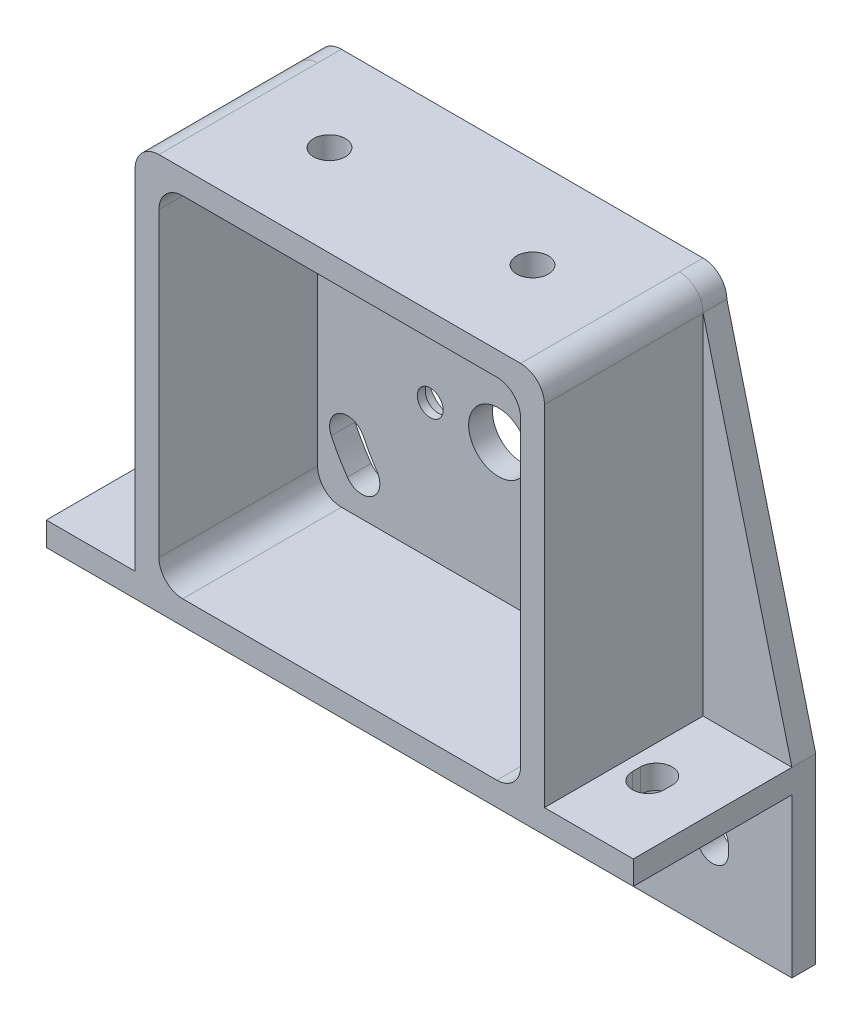
from build123d import *

# Parameters (mm, degrees)
SKETCH1_W           = 74
SKETCH1_H           = 70
SKETCH1_R           = 3.75
SKETCH1_R_2         = 1.625
BOSS_EXTRUDE1_DEPTH = 3
BOSS_EXTRUDE2_DEPTH = 20
CUT_EXTRUDE2_DEPTH  = 3
FILLET1_R           = 3
FILLET2_R           = 3
FILLET4_R           = 3
FILLET5_R           = 3
CUT_EXTRUDE4_DEPTH  = 3
FILLET6_R           = 3
FILLET7_R           = 3
FILLET8_R           = 3
FILLET9_R           = 3
SKETCH11_R          = 2
CUT_EXTRUDE5_DEPTH  = 3
SKETCH12_R          = 3.25
CUT_EXTRUDE6_DEPTH  = 2


with BuildPart() as part:
    # Sketch1 → Boss-Extrude1 (new body)
    with BuildSketch(Plane.XY):
        with Locations((37, 35)):
            Rectangle(SKETCH1_W, SKETCH1_H)
        with Locations((37, 40)):
            Circle(SKETCH1_R, mode=Mode.SUBTRACT)
        with Locations((28.4, 40)):
            Circle(SKETCH1_R_2, mode=Mode.SUBTRACT)
        with Locations((45.6, 40)):
            Circle(SKETCH1_R_2, mode=Mode.SUBTRACT)
        with BuildLine():
            Line((8, 10.5), (8, 9.5))
            ThreePointArc((8, 9.5), (10, 7.5), (12, 9.5))
            Line((12, 9.5), (12, 10.5))
            ThreePointArc((12, 10.5), (10, 12.5), (8, 10.5))
        make_face(mode=Mode.SUBTRACT)
        with BuildLine():
            Line((66, 10.5), (66, 9.5))
            ThreePointArc((66, 9.5), (64, 7.5), (62, 9.5))
            Line((62, 9.5), (62, 10.5))
            ThreePointArc((62, 10.5), (64, 12.5), (66, 10.5))
        make_face(mode=Mode.SUBTRACT)
        with BuildLine():
            ThreePointArc((34.973628981, 63.161526731), (32.928291332, 60.723988239), (35.365829823, 58.678650589))
            ThreePointArc((35.365829823, 58.678650589), (37, 58.75), (38.634170177, 58.678650589))
            ThreePointArc((38.634170177, 58.678650589), (41.071708668, 60.723988239), (39.026371019, 63.161526731))
            ThreePointArc((39.026371019, 63.161526731), (37, 63.25), (34.973628981, 63.161526731))
        make_face(mode=Mode.SUBTRACT)
        with BuildLine():
            ThreePointArc((15.928343951, 30.174125415), (17.016645383, 33.164209024), (20.006728993, 32.075907592))
            ThreePointArc((20.006728993, 32.075907592), (20.762023679, 30.625), (21.64089917, 29.245441818))
            ThreePointArc((21.64089917, 29.245441818), (21.088354052, 26.111802737), (17.95471497, 26.664347855))
            ThreePointArc((17.95471497, 26.664347855), (16.864909362, 28.375), (15.928343951, 30.174125415))
        make_face(mode=Mode.SUBTRACT)
        with BuildLine():
            ThreePointArc((58.071656049, 30.174125415), (56.983354617, 33.164209024), (53.993271007, 32.075907592))
            ThreePointArc((53.993271007, 32.075907592), (53.237976321, 30.625), (52.35910083, 29.245441818))
            ThreePointArc((52.35910083, 29.245441818), (52.911645948, 26.111802737), (56.04528503, 26.664347855))
            ThreePointArc((56.04528503, 26.664347855), (57.135090638, 28.375), (58.071656049, 30.174125415))
        make_face(mode=Mode.SUBTRACT)
    extrude(amount=BOSS_EXTRUDE1_DEPTH)

    # Sketch2 → Loft1 section 0
    with BuildSketch(Plane.XY.offset(3)):
        with BuildLine():
            Line((0, 23), (74, 23))
            Line((74, 23), (74, 20))
            Line((74, 20), (0, 20))
            Line((0, 20), (0, 23))
        make_face()
    # Sketch3 → Loft1 section 1
    with BuildSketch(Plane.XY.offset(23)):
        with BuildLine():
            Line((0, 23), (74, 23))
            Line((74, 23), (74, 20))
            Line((74, 20), (0, 20))
            Line((0, 20), (0, 23))
        make_face()
    loft()

    # Sketch4 → Boss-Extrude2 (add)
    with BuildSketch(Plane.XY.offset(3)):
        Polygon((14.2, 23), (14.2, 67), (59.8, 67), (59.8, 23), (62.8, 23), (62.8, 70), (11.2, 70), (11.2, 23), align=None)
    extrude(amount=BOSS_EXTRUDE2_DEPTH)

    # Sketch8 → Cut-Extrude2 (cut)
    with BuildSketch(Plane(origin=(0, 23, 0), x_dir=(1, 0, 0), z_dir=(0, 1, 0))):
        with BuildLine():
            Line((5.6, -12.5), (5.6, -13.5))
            ThreePointArc((5.6, -13.5), (7.6, -15.5), (9.6, -13.5))
            Line((9.6, -13.5), (9.6, -12.5))
            ThreePointArc((9.6, -12.5), (7.6, -10.5), (5.6, -12.5))
        make_face()
        with BuildLine():
            Line((68.4, -12.5), (68.4, -13.5))
            ThreePointArc((68.4, -13.5), (66.4, -15.5), (64.4, -13.5))
            Line((64.4, -13.5), (64.4, -12.5))
            ThreePointArc((64.4, -12.5), (66.4, -10.5), (68.4, -12.5))
        make_face()
    extrude(amount=-CUT_EXTRUDE2_DEPTH, mode=Mode.SUBTRACT)

    # Fillet1
    fillet1_edges = [part.edges().sort_by_distance(p)[0] for p in [
        (11.2, 70, 13),
    ]]
    fillet(fillet1_edges, radius=FILLET1_R)

    # Fillet2
    fillet2_edges = [part.edges().sort_by_distance(p)[0] for p in [
        (62.8, 70, 13),
    ]]
    fillet(fillet2_edges, radius=FILLET2_R)

    # Fillet4
    fillet4_edges = [part.edges().sort_by_distance(p)[0] for p in [
        (59.8, 67, 13),
    ]]
    fillet(fillet4_edges, radius=FILLET4_R)

    # Fillet5
    fillet5_edges = [part.edges().sort_by_distance(p)[0] for p in [
        (14.2, 67, 13),
    ]]
    fillet(fillet5_edges, radius=FILLET5_R)

    # Sketch10 → Cut-Extrude4 (cut)
    with BuildSketch(Plane.XY.offset(3)):
        Polygon((0, 23), (11.2, 67), (11.2, 70), (0, 70), align=None)
        Polygon((74, 23), (62.8, 67), (62.8, 70), (74, 70), align=None)
    extrude(amount=-CUT_EXTRUDE4_DEPTH, mode=Mode.SUBTRACT)

    # Fillet6
    fillet6_edges = [part.edges().sort_by_distance(p)[0] for p in [
        (62.8, 70, 1.5),
    ]]
    fillet(fillet6_edges, radius=FILLET6_R - 0.0001)  # a hair under: the kernel refuses the full size

    # Fillet7
    fillet7_edges = [part.edges().sort_by_distance(p)[0] for p in [
        (11.2, 70, 1.5),
    ]]
    fillet(fillet7_edges, radius=FILLET7_R - 0.0001)  # a hair under: the kernel refuses the full size

    # Fillet8
    fillet8_edges = [part.edges().sort_by_distance(p)[0] for p in [
        (14.2, 23, 13),
    ]]
    fillet(fillet8_edges, radius=FILLET8_R)

    # Fillet9
    fillet9_edges = [part.edges().sort_by_distance(p)[0] for p in [
        (59.8, 23, 13),
    ]]
    fillet(fillet9_edges, radius=FILLET9_R)

    # Sketch11 → Cut-Extrude5 (cut)
    with BuildSketch(Plane(origin=(0, 70, 0), x_dir=(1, 0, 0), z_dir=(0, 1, 0))):
        with Locations(Location((24.2, -11.5, 0), (0, 0, 270))):
            Circle(SKETCH11_R)
        with Locations(Location((49.8, -11.5, 0), (0, 0, 90))):
            Circle(SKETCH11_R)
    extrude(amount=-CUT_EXTRUDE5_DEPTH, mode=Mode.SUBTRACT)

    # Sketch12 → Cut-Extrude6 (cut)
    with BuildSketch(Plane(origin=(0, 0, 0), x_dir=(-1, 0, 0), z_dir=(0, 0, -1))):
        with Locations((-45.6, 40)):
            Circle(SKETCH12_R)
        with Locations((-28.4, 40)):
            Circle(SKETCH12_R)
    extrude(amount=-CUT_EXTRUDE6_DEPTH, mode=Mode.SUBTRACT)


solid = part.part
